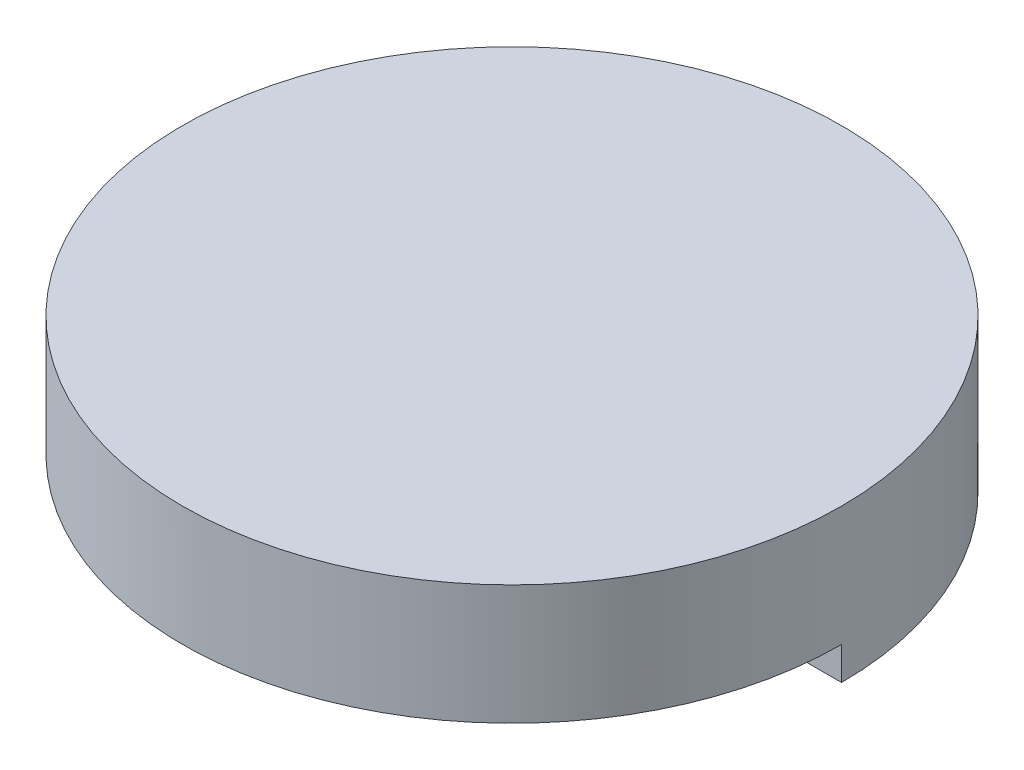
from build123d import *
from build123d.topology import SkipClean

# Parameters (mm, degrees)
SKETCH2_R           = 11
BOSS_EXTRUDE1_DEPTH = 4
BOSS_EXTRUDE2_START = -0.6
BOSS_EXTRUDE2_DEPTH = 0.6
BOSS_EXTRUDE3_START = 0.5
BOSS_EXTRUDE3_DEPTH = 0.5


with BuildPart() as part:
    # Sketch2 → Boss-Extrude1 (new body)
    with BuildSketch(Plane(origin=(0, 0, 0), x_dir=(1, 0, 0), z_dir=(0, 1, 0))):
        Circle(SKETCH2_R)
    extrude(amount=BOSS_EXTRUDE1_DEPTH)

    # Sketch3 → Boss-Extrude2 (add)
    with SkipClean():  # the faces are left unmerged after this step: merging them gives an invalid solid
        with BuildSketch(Plane(origin=(0, 0, 0), x_dir=(1, 0, 0), z_dir=(0, 1, 0)).offset(BOSS_EXTRUDE2_START)):
            with BuildLine():
                Line((-10, 0), (-11, 0))
                ThreePointArc((-11, 0), (0, 11), (11, 0))
                Line((11, 0), (10, 0))
                ThreePointArc((10, 0), (0, 10), (-10, 0))
            make_face()
        extrude(amount=BOSS_EXTRUDE2_DEPTH)

    # Sketch4 → Boss-Extrude3 (add)
    with SkipClean():  # the faces are left unmerged after this step: merging them gives an invalid solid
        with BuildSketch(Plane.XZ.offset(0.6).offset(BOSS_EXTRUDE3_START)):
            with BuildLine():
                Line((-11, 0), (-8.5, 0))
                ThreePointArc((-8.5, 0), (0, -8.5), (8.5, 0))
                Line((8.5, 0), (11, 0))
                ThreePointArc((11, 0), (0, -11), (-11, 0))
            make_face()
        extrude(amount=-BOSS_EXTRUDE3_DEPTH)


solid = part.part
